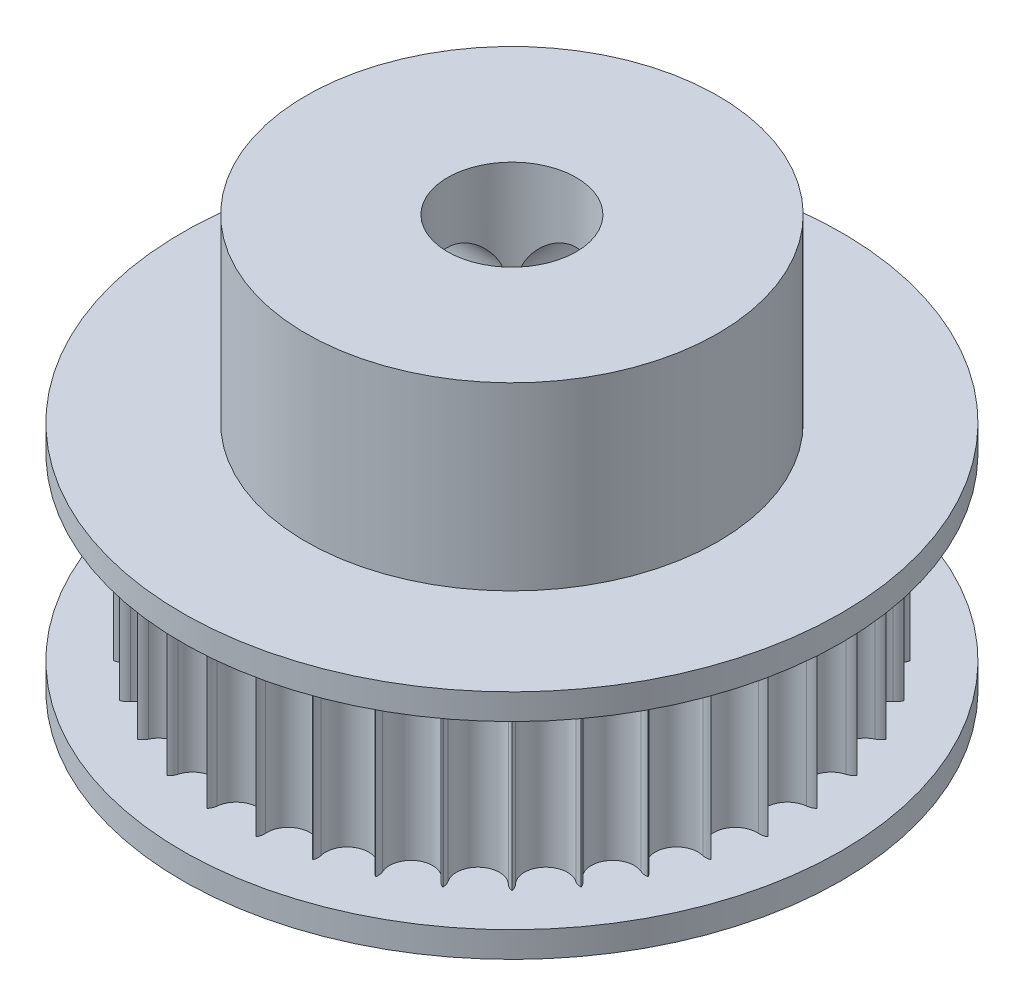
from build123d import *

# Parameters (mm, degrees)
CUT_EXTRUDE1_DEPTH      = 7
CIRPATTERN1_COUNT       = 36
CUT_EXTRUDE2_REACH      = 21.998
CUT_EXTRUDE2_END_RADIUS = 8
SKETCH3_R               = 1.65
CUT_EXTRUDE3_REACH      = 21.998
CUT_EXTRUDE3_END_RADIUS = 8
SKETCH4_R               = 1.65
CHAMFER1_SIZE           = 1


with BuildPart() as part:
    # Skica2 → Revolute (revolve)
    with BuildSketch(Plane.XY):
        Polygon((8, 8.5), (2.5, 8.5), (2.5, -8.5), (6.11, -8.5), (6.11, -7.5), (12.8, -7.5), (12.8, -6.5), (11.15, -6.5), (11.15, 0.5), (12.8, 0.5), (12.8, 1.5), (8, 1.5), align=None)
    revolve(axis=Axis((0, -8.5, 0), (0, 1, 0)))

    # Sketch2 → Cut-Extrude1 (cut)
    with BuildSketch(Plane.XZ.offset(-0.5)):
        with BuildLine():
            ThreePointArc((-0.831661365, 10.617478014), (0, 9.866329289), (0.831661365, 10.617478014))
            ThreePointArc((0.831661365, 10.617478014), (1.017799005, 10.958027157), (1.391478752, 11.062833583))
            ThreePointArc((1.391478752, 11.062833583), (1.776250939, 11.007607942), (2.1588643, 10.939003837))
            ThreePointArc((2.1588643, 10.939003837), (1.553174348, 12.383882602), (0, 12.589271032))
            ThreePointArc((0, 12.589271032), (-1.553174348, 12.383882602), (-2.1588643, 10.939003837))
            ThreePointArc((-2.1588643, 10.939003837), (-1.776250939, 11.007607942), (-1.391478752, 11.062833583))
            ThreePointArc((-1.391478752, 11.062833583), (-1.017799005, 10.958027157), (-0.831661365, 10.617478014))
        make_face()
    cut_extrude1 = extrude(amount=CUT_EXTRUDE1_DEPTH, mode=Mode.SUBTRACT)

    # CirPattern1: Cut-Extrude1 ×36 about axis
    cirpattern1_axis = Axis((0, 0, 0), (0, 1, 0))
    for i in range(1, CIRPATTERN1_COUNT):
        add(cut_extrude1.rotate(cirpattern1_axis, i * 360 / CIRPATTERN1_COUNT), mode=Mode.SUBTRACT)

    # Cut-Extrude2: up to this cylinder (the profile starts inside it)
    cut_extrude2_end = Plane(origin=(0, 4.5, 0), z_dir=(0, -1, 0)) * Cylinder(CUT_EXTRUDE2_END_RADIUS, 60.996, mode=Mode.PRIVATE)
    # Sketch3 → Cut-Extrude2 (cut, up to the surface)
    with BuildSketch(Plane(origin=(0, 0, 0), x_dir=(0, 0, -1), z_dir=(1, 0, 0)), mode=Mode.PRIVATE) as cut_extrude2_sk1:
        with Locations((0, 4.5)):
            Circle(SKETCH3_R)
    cut_extrude2_tool1 = extrude(cut_extrude2_sk1.sketch, amount=-CUT_EXTRUDE2_REACH, mode=Mode.PRIVATE) & cut_extrude2_end
    add(cut_extrude2_tool1.solids().sort_by_distance((0, 4.5, 0))[0], mode=Mode.SUBTRACT)

    # Cut-Extrude3: up to this cylinder (the profile starts inside it)
    cut_extrude3_end = Plane(origin=(0, 4.5, 0), z_dir=(0, -1, 0)) * Cylinder(CUT_EXTRUDE3_END_RADIUS, 60.996, mode=Mode.PRIVATE)
    # Sketch4 → Cut-Extrude3 (cut, up to the surface)
    with BuildSketch(Plane.XY, mode=Mode.PRIVATE) as cut_extrude3_sk1:
        with Locations((0, 4.5)):
            Circle(SKETCH4_R)
    cut_extrude3_tool1 = extrude(cut_extrude3_sk1.sketch, amount=-CUT_EXTRUDE3_REACH, mode=Mode.PRIVATE) & cut_extrude3_end
    add(cut_extrude3_tool1.solids().sort_by_distance((0, 4.5, 0))[0], mode=Mode.SUBTRACT)

    # Chamfer1
    chamfer1_edges = [part.edges().sort_by_distance(p)[0] for p in [
        (-6.11, -7.5, 0),
    ]]
    chamfer(chamfer1_edges, length=CHAMFER1_SIZE - 0.0001)  # a hair under: the kernel refuses the full size


solid = part.part
